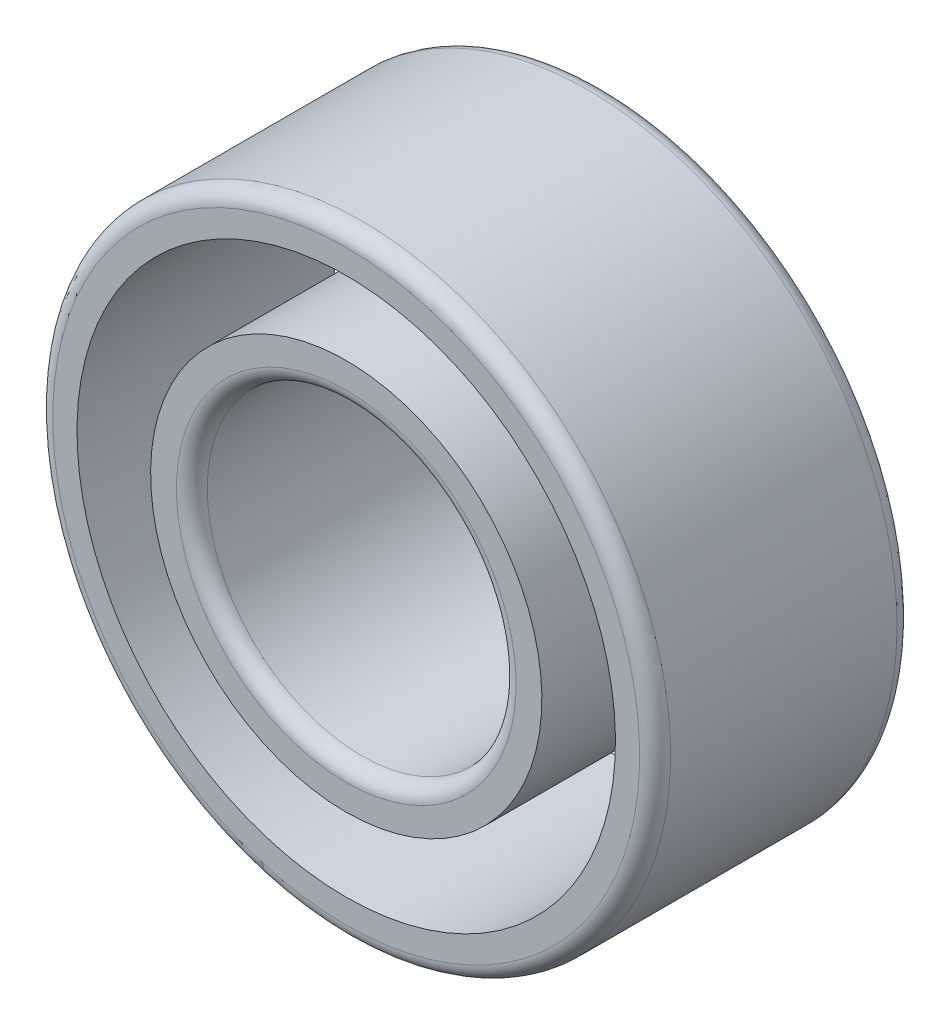
from build123d import *

# Parameters (mm, degrees)
SKETCH1_W   = 2.5
SKETCH1_H   = 0.385
SKETCH1_H_2 = 0.4
FILLET1_R   = 0.15
FILLET2_R   = 0.15


with BuildPart() as part:
    # Sketch1 → Revolve1 (revolve)
    with BuildSketch(Plane(origin=(0, 0, 0), x_dir=(0, 0, -1), z_dir=(1, 0, 0))):
        with Locations((0, 2.8075)):
            Rectangle(SKETCH1_W, SKETCH1_H)
        with Locations((0, 1.7)):
            Rectangle(SKETCH1_W, SKETCH1_H_2)
    revolve(axis=Axis((0, 0, 1.25), (0, 0, -1)))

    # Fillet1
    fillet1_edges = [part.edges().sort_by_distance(p)[0] for p in [
        (0, -3, -1.25),
        (0, -3, 1.25),
    ]]
    fillet(fillet1_edges, radius=FILLET1_R)

    # Fillet2
    fillet2_edges = [part.edges().sort_by_distance(p)[0] for p in [
        (0, -1.5, -1.25),
        (0, -1.5, 1.25),
    ]]
    fillet(fillet2_edges, radius=FILLET2_R)


solid = part.part
